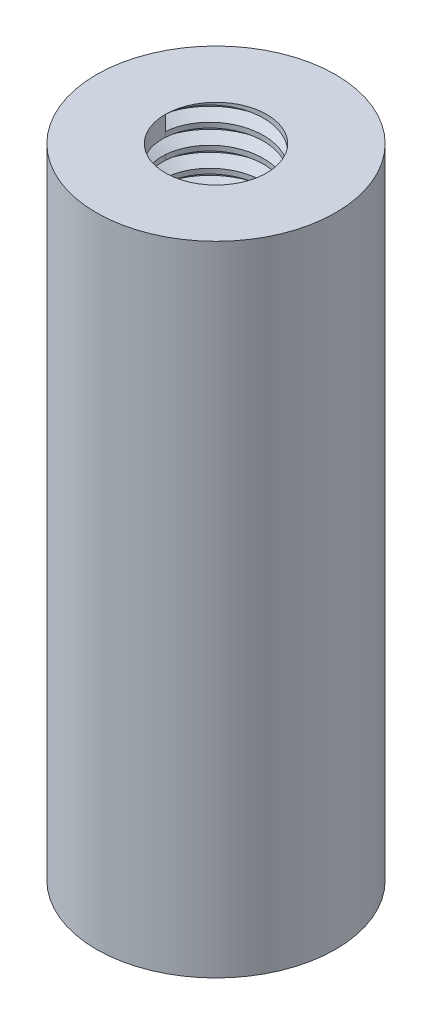
from build123d import *

# Parameters (mm, degrees)
SKETCH1_R           = 4.7625
SKETCH1_R_2         = 2.0193
BOSS_EXTRUDE1_DEPTH = 12.7
THREAD1_PITCH       = 0.79375


with BuildPart() as part:
    # Sketch1 → Boss-Extrude1 (new, symmetric)
    with BuildSketch(Plane(origin=(0, 0, 0), x_dir=(1, 0, 0), z_dir=(0, 1, 0))):
        with Locations(Location((0, 0, 0), (0, 0, 270))):
            Circle(SKETCH1_R)
        with Locations(Location((0, 0, 0), (0, 0, 270))):
            Circle(SKETCH1_R_2, mode=Mode.SUBTRACT)
    extrude(amount=BOSS_EXTRUDE1_DEPTH, both=True)

    # Thread1: the profile of Thread Profile2 profile screwed along a right-hand helix of 12 turns, 8 arcs to a turn; built about Z, then put on its axis
    thread1_z = Axis((0, 0, 0), (0, 0, 1))
    thread1_corners = [(2.019, 0, -0.000173205), (2.448929788, 0, 0.248046874), (2.448929788, 0, 0.347265624), (2.019, 0, 0.595485703)]
    with BuildLine(mode=Mode.PRIVATE) as thread1_profile:
        Line(thread1_corners[0], thread1_corners[1])
        Line(thread1_corners[1], thread1_corners[2])
        Line(thread1_corners[2], thread1_corners[3])
        Line(thread1_corners[3], thread1_corners[0])
    thread1_cap = Face(thread1_profile.wire())
    thread1_turn_angles = [0, 22.5, 45, 67.5, 90, 112.5, 135, 157.5, 180, 202.5, 225, 247.5, 270, 292.5, 315, 337.5, 360]
    thread1_turn_weights = [1, 0.9238795325112867, 1, 0.9238795325112867, 1, 0.9238795325112867, 1, 0.9238795325112867, 1, 0.9238795325112867, 1, 0.9238795325112867, 1, 0.9238795325112867, 1, 0.9238795325112867, 1]
    thread1_turn_rails = [Edge.make_bspline([Vector(p[0], p[1], 0).rotate(thread1_z, thread1_turn_angles[k]) / thread1_turn_weights[k] + Vector(0, 0, p[2] + THREAD1_PITCH * thread1_turn_angles[k] / 360) for k in range(17)], [0, 0, 0, 1, 1, 2, 2, 3, 3, 4, 4, 5, 5, 6, 6, 7, 7, 8, 8, 8], 2, thread1_turn_weights) for p in thread1_corners]
    thread1_turn_sides = [Face.make_surface_from_curves(thread1_turn_rails[p[0]], thread1_turn_rails[p[1]]) for p in [(0, 1), (1, 2), (2, 3), (3, 0)]]
    thread1 = Plane(origin=(0, 12.7, 0), x_dir=(-1, 0, 0), z_dir=(0, -1, 0)) * Solid(Shell([*[p.moved(Location((0, 0, THREAD1_PITCH * i))) for i in range(12) for p in thread1_turn_sides], thread1_cap, thread1_cap.rotate(thread1_z, 4320).moved(Location((0, 0, THREAD1_PITCH * 4320 / 360)))]))
    add(thread1, mode=Mode.SUBTRACT)

    # Mirror3: Thread1 across plane
    add(thread1.mirror(Plane.ZX), mode=Mode.SUBTRACT)


solid = part.part
